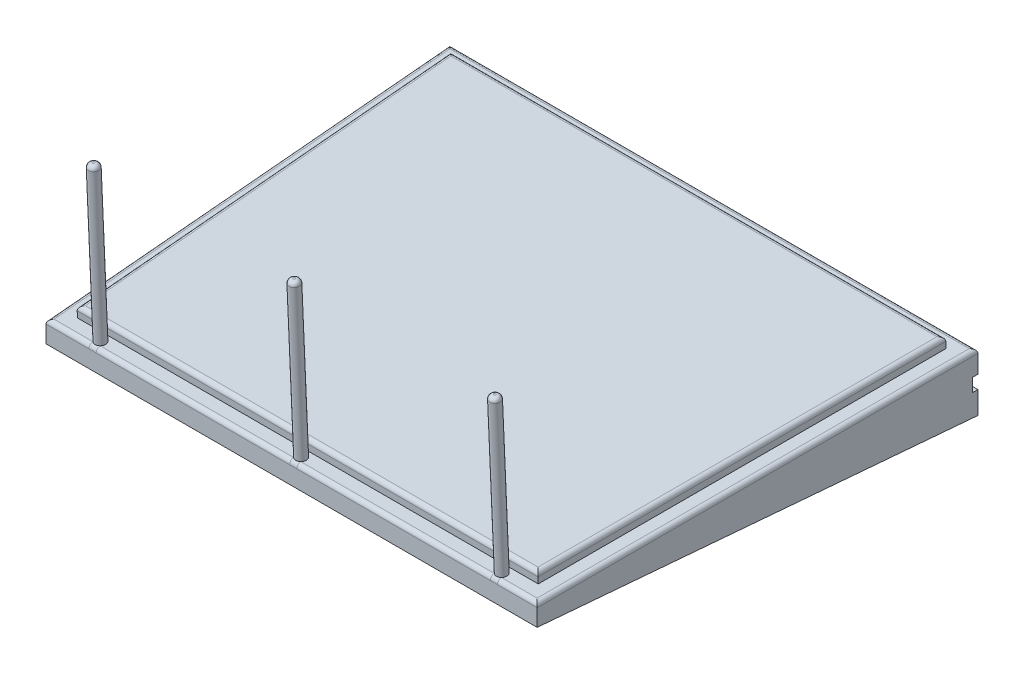
from build123d import *

# Parameters (mm, degrees)
ESQUISSE1_W                = 100
ESQUISSE1_H                = 15
BOSS_EXTRU_1_DEPTH         = 80
BOSS_EXTRU_1_TAPER         = 2.5
ESQUISSE2_W                = 1
ESQUISSE2_H                = 2.5
ENL_V_MAT_EXTRU_1_DEPTH    = 127.859596195
ENL_V_MAT_EXTRU_2_DEPTH    = 2
ESQUISSE5_R                = 1
R_P_TITION_LIN_AIRE1_COUNT = 3
R_P_TITION_LIN_AIRE1_PITCH = 38
CONG_1_R                   = 0.8
CONG_2_R                   = 0.8


with BuildPart() as part:
    # Esquisse1 → Boss.-Extru.1 (new body)
    with BuildSketch(Plane.XY):
        Rectangle(ESQUISSE1_W, ESQUISSE1_H)
    extrude(amount=BOSS_EXTRU_1_DEPTH, taper=BOSS_EXTRU_1_TAPER)

    # Esquisse2 → Enlèv. mat.-Extru.1 (cut, through all)
    with BuildSketch(Plane(origin=(49.904867452, 0, 2.178893569), x_dir=(0.043619387365336104, 0, -0.9990482215818578), z_dir=(0.9990482215818577, 0, 0.0436193873653361))):
        with Locations((1.680969368, 0)):
            Rectangle(ESQUISSE2_W, ESQUISSE2_H)
    enl_v_mat_extru_1 = extrude(amount=-ENL_V_MAT_EXTRU_1_DEPTH, mode=Mode.SUBTRACT)

    # Symétrie1: Enlèv. mat.-Extru.1 across plane
    add(enl_v_mat_extru_1.mirror(Plane(origin=(0, 0, 0), x_dir=(0, 0, 1), z_dir=(1, 0, 0))), mode=Mode.SUBTRACT)

    # Esquisse3 → Enlèv. mat.-Extru.2 (cut)
    with BuildSketch(Plane(origin=(0, 7.485730118, 0.326834035), x_dir=(1, 0, 0), z_dir=(0, 0.9990482215818577, 0.0436193873653361))):
        Polygon((53.133710782, 3.327145405), (-53.133710782, 3.327145405), (-49.379119025, -82.749069408), (49.379119025, -82.749069408), align=None)
        Polygon((46.866289218, -2.672854595), (-46.866289218, -2.672854595), (-43.635130109, -76.749069408), (43.635130109, -76.749069408), align=None, mode=Mode.SUBTRACT)
    enl_v_mat_extru_2 = extrude(amount=-ENL_V_MAT_EXTRU_2_DEPTH, mode=Mode.SUBTRACT)

    # Symétrie2: Enlèv. mat.-Extru.2 across plane
    add(enl_v_mat_extru_2.mirror(Plane.ZX), mode=Mode.SUBTRACT)

    # Balayage1: sweep along a path in Esquisse4
    with BuildLine(Plane(origin=(0, -3.347747388, 76.6760213), x_dir=(1, 0, 0), z_dir=(0, -0.043619387365336104, 0.9990482215818578))) as balayage1_path:
        Line((-37.620500895, 5.492861662), (-37.620500895, 35.492861662))
    # Esquisse5 → Balayage1 (sweep)
    with BuildSketch(Plane(origin=(0, 5.487633675, 0.239595261), x_dir=(1, 0, 0), z_dir=(0, 0.9990482215818578, 0.04361938736533611))):
        with Locations((-37.691661974, -78.336391294)):
            Circle(ESQUISSE5_R)
    balayage1 = sweep(path=balayage1_path.line)

    # Répétition linéaire1: Balayage1 ×3
    with Locations(*[(i * R_P_TITION_LIN_AIRE1_PITCH, 0, 0) for i in range(1, R_P_TITION_LIN_AIRE1_COUNT)]):
        add(balayage1)

    # Congé1
    cong_1_edges = [part.edges().sort_by_distance(p)[0] for p in [
        (37.308338026, 32.042094925, 79.810009289),
        (-0.691661974, 32.042094925, 79.810009289),
        (-38.691661974, 32.042094925, 79.810009289),
    ]]
    fillet(cong_1_edges, radius=CONG_1_R)

    # Congé2
    cong_2_edges = [part.edges().sort_by_distance(p)[0] for p in [
        (0, 4.137982729, 77.002855335),
        (0, 2.005219197, 80),
        (-48.253562284, 3.751656913, 40),
        (-45.250709663, 5.753562284, 40),
        (45.250709663, 5.753562284, 40),
        (0, 7.369141838, 2.997144665),
        (0, 5.49809463, 0),
        (48.253562284, 3.751656913, 40),
    ]]
    fillet(cong_2_edges, radius=CONG_2_R)


solid = part.part
